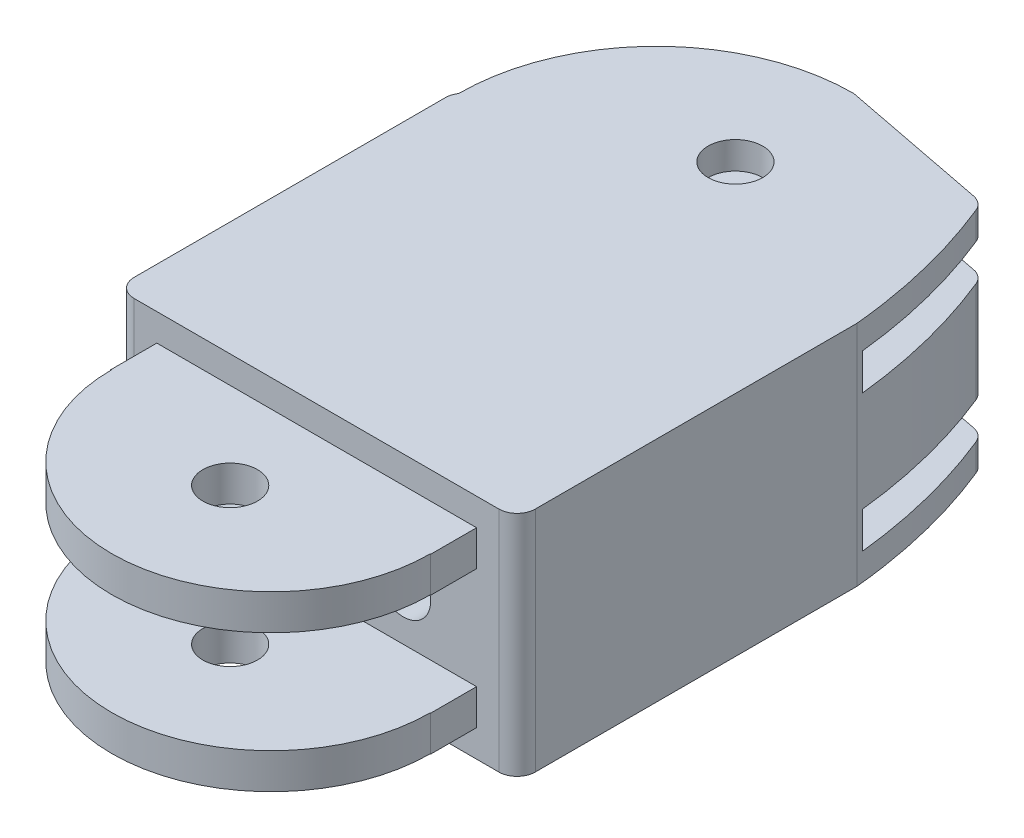
from build123d import *

# Parameters (mm, degrees)
SKETCH2_W             = 17.554431489
SKETCH2_H             = 1.95
BOSS_EXTRUDE1_DEPTH   = 8.75
BOSS_EXTRUDE1_2_DEPTH = 8.75
CUT_EXTRUDE1_DEPTH    = 26.518349076
SKETCH4_W             = 22.027215745
SKETCH4_H             = 12.505427167
BOSS_EXTRUDE2_DEPTH   = 32
SKETCH5_R             = 1.5
CUT_EXTRUDE2_DEPTH    = 12
SKETCH6_W             = 22.027215745
SKETCH6_H             = 12.505427167
SKETCH6_W_2           = 17.554431489
SKETCH6_H_2           = 1.95
CUT_EXTRUDE3_DEPTH    = 2.5
SKETCH7_R             = 1.5
CUT_EXTRUDE4_DEPTH    = 13
SKETCH8_R             = 1.5
CUT_EXTRUDE5_DEPTH    = 28
FILLET3_R             = 1
SKETCH9_W             = 22.02721574
SKETCH9_H             = 2
CUT_EXTRUDE6_DEPTH    = 11


with BuildPart() as part:
    # Sketch2 → Boss-Extrude1 (new body)
    with BuildSketch(Plane.XY):
        with Locations((-13.228930986, -27.845183414)):
            Rectangle(SKETCH2_W, SKETCH2_H)
    extrude(amount=BOSS_EXTRUDE1_DEPTH)


with BuildPart() as body_2:
    # Sketch2 → Boss-Extrude1 2 (new body)
    with BuildSketch(Plane.XY):
        with Locations((-13.228930986, -20.289756247)):
            Rectangle(SKETCH2_W, SKETCH2_H)
    extrude(amount=BOSS_EXTRUDE1_2_DEPTH)


with BuildPart() as cut_extrude1_tool:
    # Sketch3 → Cut-Extrude1 (new, through all)
    with BuildSketch(Plane(origin=(0, -19.314756247, 0), x_dir=(1, 0, 0), z_dir=(0, 1, 0))):
        with BuildLine():
            ThreePointArc((-13.228930986, -8.75), (-7.041746651, -6.187184335), (-4.478930986, 0))
            add(Edge.make_bspline(
                [(-4.478930986, 0), (1.138349918, -4.151657709), (-4.451715242, -8.75)],
                knots=[0, 0, 0, 1, 1, 1], degree=2))
            add(Edge.make_bspline(
                [(-22.006146731, -8.75), (-13.228930986, -12.473510392), (-4.451715242, -8.75)],
                knots=[0, 0, 0, 1, 1, 1], degree=2))
            add(Edge.make_bspline(
                [(-21.978930986, 0), (-25.926969228, -4.242865138), (-22.006146731, -8.75)],
                knots=[0, 0, 0, 1, 1, 1], degree=2))
            ThreePointArc((-21.978930986, 0), (-19.416115322, -6.187184335), (-13.228930986, -8.75))
        make_face()
    extrude(amount=-CUT_EXTRUDE1_DEPTH)


with BuildPart() as part_1:
    add(part.part)

    # Cut-Extrude1: cut by cut_extrude1_tool
    add(cut_extrude1_tool.part, mode=Mode.SUBTRACT)



with BuildPart() as body_2_1:
    add(body_2.part)

    # Cut-Extrude1: cut by cut_extrude1_tool
    add(cut_extrude1_tool.part, mode=Mode.SUBTRACT)


with BuildPart() as part_2:
    add(part_1.part)

    add(body_2_1.part)  # Boss-Extrude2 merges body 2
    # Sketch4 → Boss-Extrude2 (add)
    with BuildSketch(Plane(origin=(0, 0, 0), x_dir=(-1, 0, 0), z_dir=(0, 0, -1))):
        with Locations((13.242538859, -24.067469831)):
            Rectangle(SKETCH4_W, SKETCH4_H)
    extrude(amount=BOSS_EXTRUDE2_DEPTH)

    # Sketch5 → Cut-Extrude2 (cut)
    with BuildSketch(Plane(origin=(0, -19.314756247, 0), x_dir=(1, 0, 0), z_dir=(0, 1, 0))):
        with Locations(Location((-13.228930986, -2.25, 0), (0, 0, 270))):
            Circle(SKETCH5_R)
    extrude(amount=-CUT_EXTRUDE2_DEPTH, mode=Mode.SUBTRACT)

    # Sketch6 → Cut-Extrude3 (cut)
    with BuildSketch(Plane.XY):
        with Locations((-13.242538859, -24.067469831)):
            Rectangle(SKETCH6_W, SKETCH6_H)
        with Locations((-13.228930986, -27.845183414)):
            Rectangle(SKETCH6_W_2, SKETCH6_H_2, mode=Mode.SUBTRACT)
        with Locations((-13.228930986, -20.289756247)):
            Rectangle(SKETCH6_W_2, SKETCH6_H_2, mode=Mode.SUBTRACT)
    extrude(amount=-CUT_EXTRUDE3_DEPTH, mode=Mode.SUBTRACT)

    # Sketch7 → Cut-Extrude4 (cut)
    with BuildSketch(Plane(origin=(0, -17.814756247, 0), x_dir=(1, 0, 0), z_dir=(0, 1, 0))):
        with Locations(Location((-13.242538859, 25.5, 0), (0, 0, 270))):
            Circle(SKETCH7_R)
        with BuildLine():
            Line((-24.086865874, 21.155672985), (-24.256146731, 21.155672985))
            add(Edge.make_bspline(
                [(-2.228930986, 21.155672985), (11.471530889, 27.189710441), (-11.765166974, 53.431279988), (-37.007876173, 21.523583672), (-24.256146731, 21.155672985)],
                knots=[0, 0, 0, 0, 0.52011282, 1, 1, 1, 1], degree=3))
            add(Edge.make_bspline(
                [(-4.552660132, 30.311399113), (-2.685211009, 25.928521854), (-2.228930986, 21.155672985)],
                knots=[0, 0, 0, 1, 1, 1], degree=2))
            Line((-4.552660132, 30.311399113), (-13.242538859, 32))
            ThreePointArc((-13.242538859, 32), (-20.910636028, 28.823770155), (-24.086865874, 21.155672985))
        make_face()
    extrude(amount=-CUT_EXTRUDE4_DEPTH, mode=Mode.SUBTRACT)

    # Sketch8 → Cut-Extrude5 (cut)
    with BuildSketch(Plane.XY.offset(-2.5)):
        with Locations((-18.011106811, -24.06746983)):
            Circle(SKETCH8_R)
        with Locations((-8.473970906, -24.06746983)):
            Circle(SKETCH8_R)
    extrude(amount=-CUT_EXTRUDE5_DEPTH, mode=Mode.SUBTRACT)

    # Fillet3
    # the kernel refuses this fillet: 1 mm, written as the material it takes off along each edge
    with BuildSketch(Plane(origin=(-24.256146731, -15.314756247, -2.5), x_dir=(0, 0, -1), z_dir=(0, -1, 0)), Plane(origin=(-2.228930986, -32.820183414, -2.5), x_dir=(0, 0, -1), z_dir=(0, 1, 0))) as fillet3_piece_1:
        with BuildLine():
            CenterArc((FILLET3_R, FILLET3_R), FILLET3_R, 180, 90)
            Line((0, FILLET3_R), (-FILLET3_R * 0.02, FILLET3_R))
            Line((-FILLET3_R * 0.02, FILLET3_R), (-FILLET3_R * 0.02, -FILLET3_R * 0.02))
            Line((-FILLET3_R * 0.02, -FILLET3_R * 0.02), (FILLET3_R, -FILLET3_R * 0.02))
            Line((FILLET3_R, -FILLET3_R * 0.02), (FILLET3_R, 0))
        make_face()
    extrude(amount=17.505427167, mode=Mode.SUBTRACT)
    with BuildSketch(Plane(origin=(-24.256146731, -16.423026869, -21.155672985), x_dir=(1.0, 0, 2.5394386720559264e-12), z_dir=(0, -1, 0))) as fillet3_piece_2:
        with BuildLine():
            CenterArc((1, 0.556691751), FILLET3_R, 180, 33.827317624)
            Line((0, 0.556691751), (-0.02, 0.556691751))
            Line((-0.02, 0.556691751), (-0.02, 0))
            Line((-0.02, 0), (0, -0.02))
            ThreePointArc((0, -0.02), (0.084640429, -0.02), (0.152666474, -0.011133835))
            Line((0.152666474, -0.011133835), (0.169280857, 0))
        make_face()
    extrude(amount=15.288885922, mode=Mode.SUBTRACT)
    with BuildSketch(Plane(origin=(-4.552660132, -16.451585564, -30.311399113), x_dir=(0.3839298520349852, 0, 0.9233622629912891), z_dir=(0, -1, 0))) as fillet3_piece_3:
        with BuildLine():
            CenterArc((0.536514164, 0.999961682), FILLET3_R, 213.573886674, 56.927693277)
            Line((-0.296659206, 0.446949805), (-0.313322674, 0.435889568))
            Line((-0.313322674, 0.435889568), (-0.016663467, -0.011060238))
            Line((-0.016663467, -0.011060238), (-0.0001747, -0.019999237))
            ThreePointArc((-0.0001747, -0.019999237), (0.272634035, -0.021192075), (0.545443356, -0.019999234))
            Line((0.545443356, -0.019999234), (0.545268273, 0))
        make_face()
    extrude(amount=15.231768533, mode=Mode.SUBTRACT)

    # Sketch9 → Cut-Extrude6 (cut)
    with BuildSketch(Plane.XY.offset(-32.5)):
        with Locations((-13.24253886, -20.31475625)):
            Rectangle(SKETCH9_W, SKETCH9_H)
        with Locations((-13.24253886, -27.836055834)):
            Rectangle(SKETCH9_W, SKETCH9_H)
    extrude(amount=CUT_EXTRUDE6_DEPTH, mode=Mode.SUBTRACT)


solid = part_2.part
